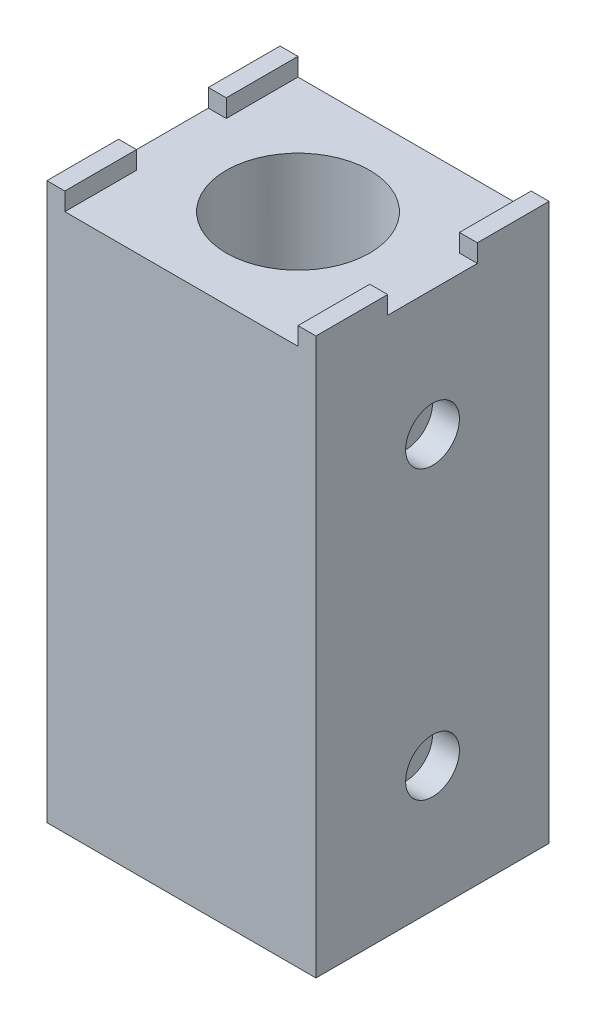
from build123d import *

# Parameters (mm, degrees)
SKETCH2_W                    = 15
SKETCH2_H                    = 13
BOSS_EXTRUDE1_DEPTH          = 30
SKETCH3_W                    = 1
SKETCH3_H                    = 4
BOSS_EXTRUDE2_DEPTH          = 1
SKETCH4_R                    = 4
CUT_EXTRUDE3_DEPTH           = 22
SKETCH5_R                    = 2
CUT_EXTRUDE4_DEPTH           = 5
SKETCH7_R                    = 1.5
CUT_EXTRUDE5_DEPTH           = 30.706901555
FILLET4_R                    = 3
FILLET5_R                    = 3
F_8_0_3_DIAMETER_HOLE1_D     = 3
F_8_0_3_DIAMETER_HOLE1_DEPTH = 1.5


with BuildPart() as part:
    # Sketch2 → Boss-Extrude1 (new body)
    with BuildSketch(Plane(origin=(0, 0, 0), x_dir=(1, 0, 0), z_dir=(0, 1, 0))):
        Rectangle(SKETCH2_W, SKETCH2_H)
    extrude(amount=BOSS_EXTRUDE1_DEPTH)

    # Sketch3 → Boss-Extrude2 (add)
    with BuildSketch(Plane(origin=(0, 30, 0), x_dir=(1, 0, 0), z_dir=(0, 1, 0))):
        with Locations((7, 4.5)):
            Rectangle(SKETCH3_W, SKETCH3_H)
        with Locations((7, -4.5)):
            Rectangle(SKETCH3_W, SKETCH3_H)
        with Locations((-7, -4.5)):
            Rectangle(SKETCH3_W, SKETCH3_H)
        with Locations((-7, 4.5)):
            Rectangle(SKETCH3_W, SKETCH3_H)
    extrude(amount=BOSS_EXTRUDE2_DEPTH)

    # Sketch4 → Cut-Extrude3 (cut)
    with BuildSketch(Plane(origin=(0, 30, 0), x_dir=(1, 0, 0), z_dir=(0, 1, 0))):
        with Locations(Location((0, 0, 0), (0, 0, 270))):
            Circle(SKETCH4_R)
    extrude(amount=-CUT_EXTRUDE3_DEPTH, mode=Mode.SUBTRACT)

    # Sketch5 → Cut-Extrude4 (cut)
    with BuildSketch(Plane(origin=(0, 8, 0), x_dir=(1, 0, 0), z_dir=(0, 1, 0))):
        with Locations(Location((0, 0, 0), (0, 0, 270))):
            Circle(SKETCH5_R)
    extrude(amount=-CUT_EXTRUDE4_DEPTH, mode=Mode.SUBTRACT)

    # Sketch7 → Cut-Extrude5 (cut, through all)
    with BuildSketch(Plane(origin=(0, 3, 0), x_dir=(1, 0, 0), z_dir=(0, 1, 0))):
        with Locations(Location((0, 0, 0), (0, 0, 270))):
            Circle(SKETCH7_R)
    extrude(amount=-CUT_EXTRUDE5_DEPTH, mode=Mode.SUBTRACT)

    # Fillet4
    # the kernel refuses this fillet: 3 mm, written as the material it takes off along each edge
    with BuildSketch(Plane(origin=(0, 8, 0), x_dir=(0, 0, 1), z_dir=(-1, 0, 0))) as fillet4_piece_1:
        with BuildLine():
            CenterArc((5, -2.828427125), FILLET4_R, 109.471220634, 70.528779366)
            Line((2, -2.828427125), (1.94, -2.828427125))
            Line((1.94, -2.828427125), (1.94, 0))
            Line((1.94, 0), (2, 0.06))
            ThreePointArc((2, 0.06), (3, 0.06), (3.98, 0.056568542))
            Line((3.98, 0.056568542), (4, 0))
        make_face()
    revolve(axis=Axis((0, 8, 0), (0, 1, 0)), mode=Mode.SUBTRACT)

    # Fillet5
    # the kernel refuses this fillet: 3 mm, written as the material it takes off along each edge
    with BuildSketch(Plane(origin=(0, 3, 0), x_dir=(0, 0, 1), z_dir=(-1, 0, 0))) as fillet5_piece_1:
        with BuildLine():
            CenterArc((4.5, -1.658312395), FILLET5_R, 146.442690238, 33.557309762)
            Line((2, 0), (1.95, 0.033166248))
            ThreePointArc((1.95, 0.033166248), (1.75, 0.06), (1.5, 0.06))
            Line((1.5, 0.06), (1.44, 0))
            Line((1.44, 0), (1.44, -1.658312395))
            Line((1.44, -1.658312395), (1.5, -1.658312395))
        make_face()
    revolve(axis=Axis((0, 3, 0), (0, 1, 0)), mode=Mode.SUBTRACT)

    # Ø8.0 (3) Diameter Hole1
    with Locations(Plane(origin=(7.5, 7, 0), x_dir=(0, 0, 1), z_dir=(1, 0, 0))):
        with Locations((0, 0), (0, -16)):
            Hole(F_8_0_3_DIAMETER_HOLE1_D / 2, depth=F_8_0_3_DIAMETER_HOLE1_DEPTH)


solid = part.part
